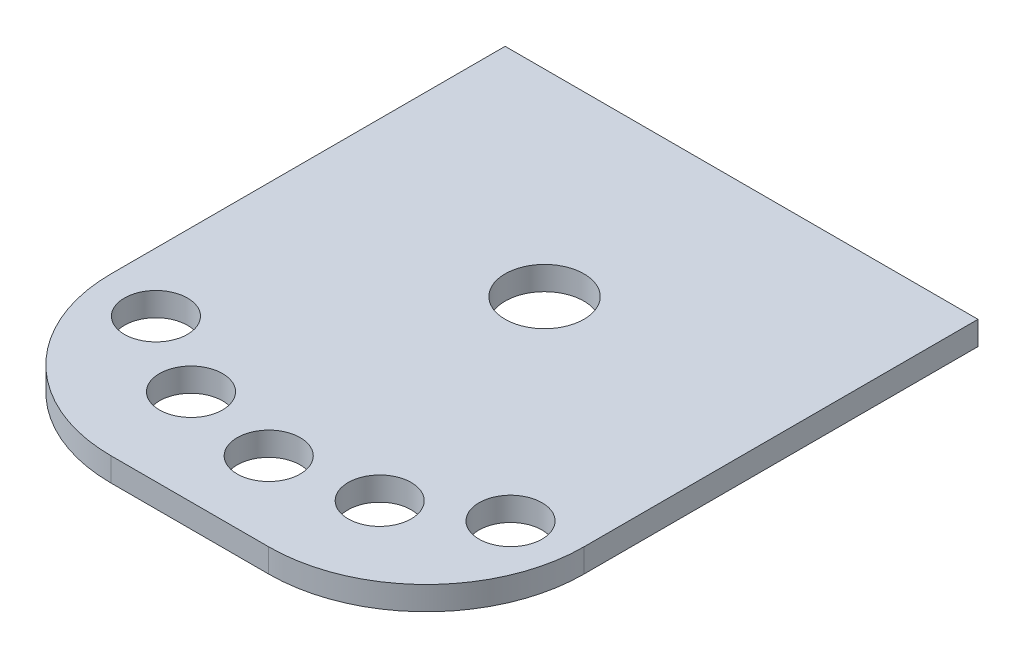
from build123d import *

# Parameters (mm, degrees)
ESBO_O1_R          = 4
ESBO_O1_R_2        = 5
FLANGE_BASE1_DEPTH = 3


# Sheet-metal steps are written as plain solids
with BuildPart() as part:
    # Esboço1 → Flange-base1 (new body)
    with BuildSketch(Plane(origin=(0, 0, 0), x_dir=(1, 0, 0), z_dir=(0, 1, 0))):
        with BuildLine():
            Line((0, 0), (0, 50))
            Line((0, 50), (60, 50))
            Line((60, 50), (60, 0))
            ThreePointArc((60, 0), (54.142135624, -14.142135624), (40, -20))
            Line((40, -20), (20, -20))
            ThreePointArc((20, -20), (5.857864376, -14.142135624), (0, 0))
        make_face()
        with Locations(Location((30, -10, 0), (0, 0, 270))):
            Circle(ESBO_O1_R, mode=Mode.SUBTRACT)
        with Locations(Location((18.029294984, -7.889241728, 0), (0, 0, 270))):
            Circle(ESBO_O1_R, mode=Mode.SUBTRACT)
        with Locations(Location((7.502433661, -1.811555509, 0), (0, 0, 270))):
            Circle(ESBO_O1_R, mode=Mode.SUBTRACT)
        with Locations(Location((52.497566339, -1.811555509, 0), (0, 0, 90))):
            Circle(ESBO_O1_R, mode=Mode.SUBTRACT)
        with Locations(Location((41.970705016, -7.889241728, 0), (0, 0, 90))):
            Circle(ESBO_O1_R, mode=Mode.SUBTRACT)
        with Locations(Location((30, 25, 0), (0, 0, 270))):
            Circle(ESBO_O1_R_2, mode=Mode.SUBTRACT)
    extrude(amount=-FLANGE_BASE1_DEPTH)


solid = part.part
